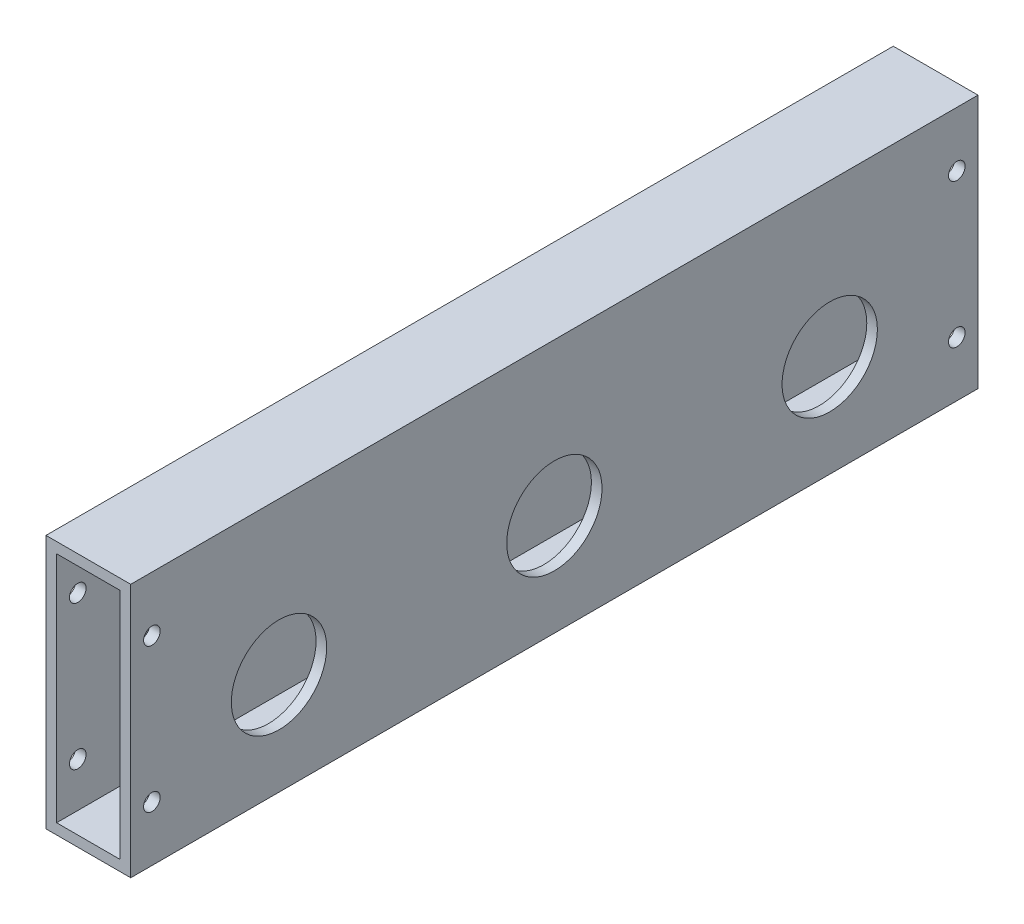
from build123d import *

# Parameters (mm, degrees)
SKETCH1_W              = 254
SKETCH1_H              = 76.2
BOSS_EXTRUDE1_DEPTH    = 25.4
SHELL1_T               = -3.175
SKETCH2_R              = 14.2875
CUT_EXTRUDE1_DEPTH     = 136.002851822
F_10_CLEARANCE_HOLE1_D = 4.9784


with BuildPart() as part:
    # Sketch1 → Boss-Extrude1 (new body)
    with BuildSketch(Plane(origin=(0, 0, 0), x_dir=(0, 0, -1), z_dir=(1, 0, 0))):
        Rectangle(SKETCH1_W, SKETCH1_H)
    extrude(amount=BOSS_EXTRUDE1_DEPTH)

    # Shell1
    shell1_openings = [part.faces().sort_by_distance(p)[0] for p in [
        (12.7, 0, -127),
        (12.7, 0, 127),
    ]]
    offset(amount=SHELL1_T, openings=shell1_openings, kind=Kind.INTERSECTION)

    # Sketch2 → Cut-Extrude1 (cut, through all)
    with BuildSketch(Plane(origin=(25.4, 0, 0), x_dir=(0, 0, -1), z_dir=(1, 0, 0))):
        with Locations((0, -7.62)):
            Circle(SKETCH2_R)
        with Locations((-82.55, -7.62)):
            Circle(SKETCH2_R)
        with Locations((82.55, -7.62)):
            Circle(SKETCH2_R)
    extrude(amount=-CUT_EXTRUDE1_DEPTH, mode=Mode.SUBTRACT)

    # #10 Clearance Hole1 (through all)
    with Locations(Plane(origin=(25.4, 0, 0), x_dir=(0, 0, -1), z_dir=(1, 0, 0))):
        with Locations((-120.65, 21.59), (-120.65, -21.59)):
            f_10_clearance_hole1 = Hole(F_10_CLEARANCE_HOLE1_D / 2)

    # Mirror1: #10 Clearance Hole1 across plane
    add(f_10_clearance_hole1.mirror(Plane.XY), mode=Mode.SUBTRACT)


solid = part.part
